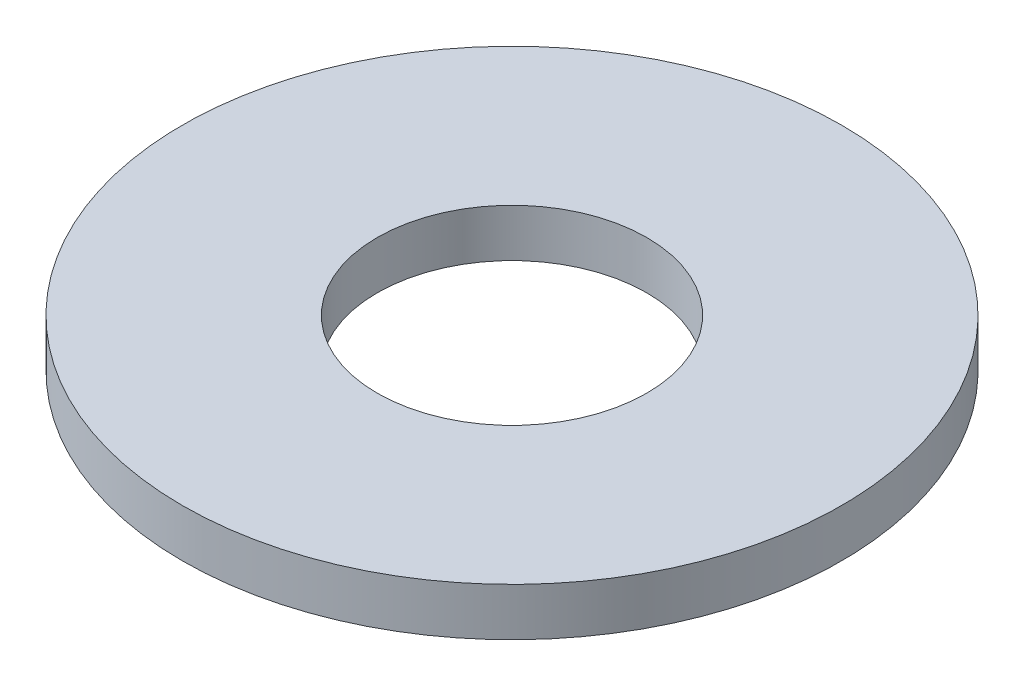
from build123d import *

# Parameters (mm, degrees)
SKETCH1_R           = 55
BOSS_EXTRUDE1_DEPTH = 8
SKETCH2_R           = 22.5
CUT_EXTRUDE1_DEPTH  = 79.192071209


with BuildPart() as part:
    # Sketch1 → Boss-Extrude1 (new body)
    with BuildSketch(Plane(origin=(0, 0, 0), x_dir=(1, 0, 0), z_dir=(0, 1, 0))):
        Circle(SKETCH1_R)
    extrude(amount=BOSS_EXTRUDE1_DEPTH)

    # Sketch2 → Cut-Extrude1 (cut, through all)
    with BuildSketch(Plane(origin=(0, 0, 0), x_dir=(1, 0, 0), z_dir=(0, 1, 0))):
        Circle(SKETCH2_R)
    extrude(amount=CUT_EXTRUDE1_DEPTH, mode=Mode.SUBTRACT)


solid = part.part
